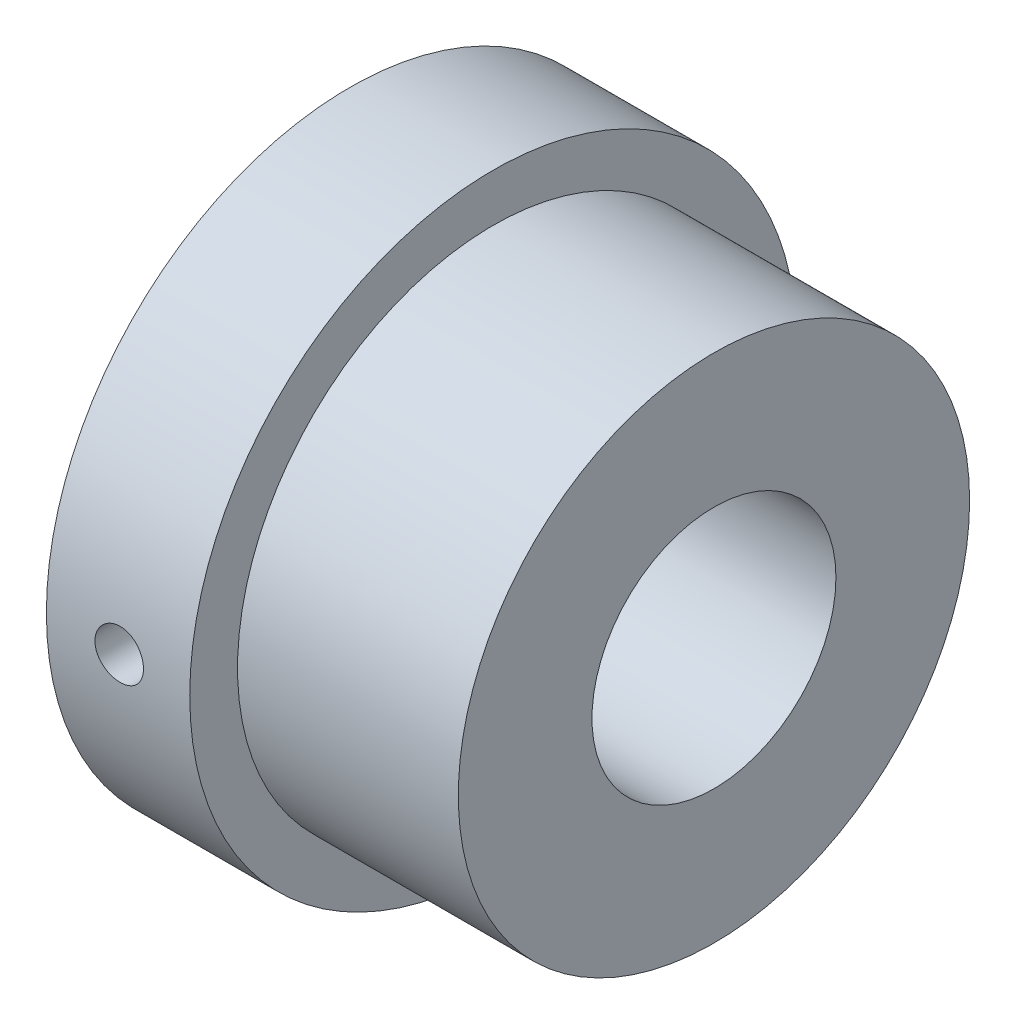
from build123d import *

# Parameters (mm, degrees)
SKETCH1_R                       = 6.35
SKETCH1_R_2                     = 2.5527
BOSS_EXTRUDE1_DEPTH             = 7.62
SKETCH2_W                       = 4.62
SKETCH2_H                       = 1
F_1_32_0_03125_DIAMETER_HOLE1_D = 0.79375


with BuildPart() as part:
    # Sketch1 → Boss-Extrude1 (new body)
    with BuildSketch(Plane(origin=(0, 0, 0), x_dir=(0, 0, -1), z_dir=(1, 0, 0))):
        Circle(SKETCH1_R)
        Circle(SKETCH1_R_2, mode=Mode.SUBTRACT)
    extrude(amount=BOSS_EXTRUDE1_DEPTH)

    # Sketch2 → Cut-Revolve1 (revolve, cut)
    with BuildSketch(Plane.XY):
        with Locations((5.31, 5.85)):
            Rectangle(SKETCH2_W, SKETCH2_H)
    revolve(axis=Axis((7.62, 0, 0), (-1, 0, 0)), mode=Mode.SUBTRACT)

    # Sketch3 → #60 (0.04) Diameter Hole1 (revolve, cut)
    with BuildSketch(Plane.YZ.offset(1.524)):
        Polygon((0, 0), (0, 25.705237194), (0.508, 25.4), (0.508, 0), align=None)
    revolve(axis=Axis((1.524, 0, -6.35), (0, 0, 1)), mode=Mode.SUBTRACT)

    # 1/32 (0.03125) Diameter Hole1 (through all)
    with Locations(Plane(origin=(0, 0, -5.08), x_dir=(1, 0, 0), z_dir=(0, 0, -1))):
        with Locations((1.524, 5.08)):
            Hole(F_1_32_0_03125_DIAMETER_HOLE1_D / 2)


solid = part.part
